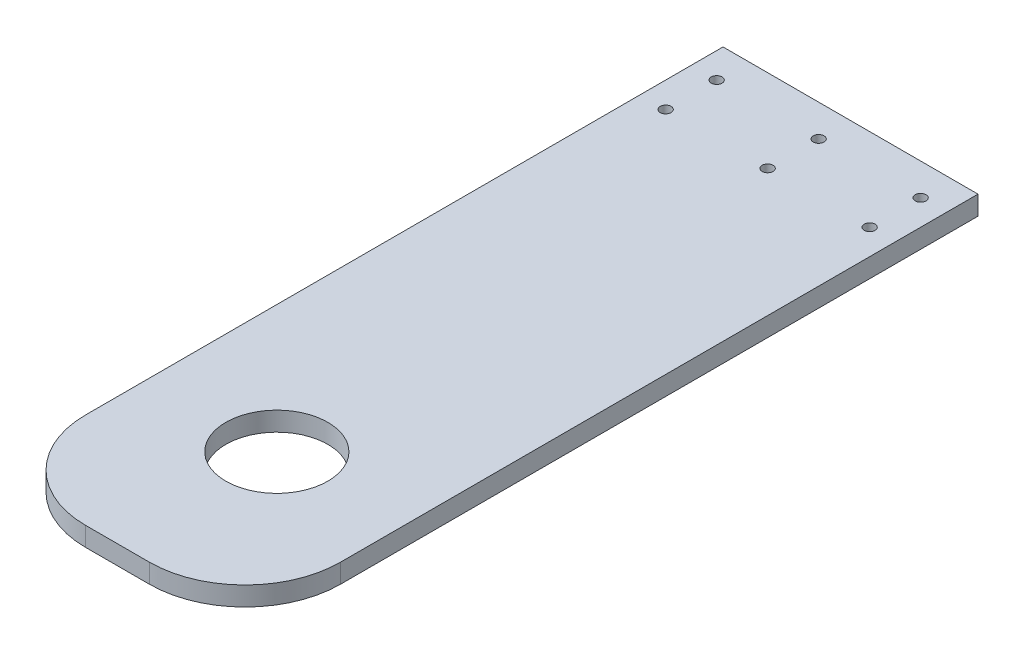
from build123d import *

# Parameters (mm, degrees)
SKETCH1_W                                           = 80
SKETCH1_H                                           = 230
BOSS_EXTRUDE1_DEPTH                                 = 6
F_32_0_32_DIAMETER_HOLE1_D                          = 32
FILLET1_R                                           = 30
CBORE_FOR_M3_HEX_SOCKET_HEAD_CAP_SCREW1_D           = 3.4
CBORE_FOR_M3_HEX_SOCKET_HEAD_CAP_SCREW1_CBORE_D     = 6.5
CBORE_FOR_M3_HEX_SOCKET_HEAD_CAP_SCREW1_CBORE_DEPTH = 3.4


with BuildPart() as part:
    # Sketch1 → Boss-Extrude1 (new body)
    with BuildSketch(Plane(origin=(0, 0, 0), x_dir=(1, 0, 0), z_dir=(0, 1, 0))):
        with Locations((40, -115)):
            Rectangle(SKETCH1_W, SKETCH1_H)
    extrude(amount=BOSS_EXTRUDE1_DEPTH)

    # Ø32.0 (32) Diameter Hole1 (through all)
    with Locations(Plane(origin=(0, 6, 0), x_dir=(1, 0, 0), z_dir=(0, 1, 0))):
        with Locations((40, -180)):
            Hole(F_32_0_32_DIAMETER_HOLE1_D / 2)

    # Fillet1
    fillet1_edges = [part.edges().sort_by_distance(p)[0] for p in [
        (0, 3, 230),
        (80, 3, 230),
    ]]
    fillet(fillet1_edges, radius=FILLET1_R)

    # CBORE for M3 Hex Socket Head Cap Screw1 (through all)
    with Locations(Plane.XZ):
        with Locations((8, 10), (40, 10), (72, 10), (40, 26), (72, 26), (8, 26)):
            CounterBoreHole(CBORE_FOR_M3_HEX_SOCKET_HEAD_CAP_SCREW1_D / 2, CBORE_FOR_M3_HEX_SOCKET_HEAD_CAP_SCREW1_CBORE_D / 2, CBORE_FOR_M3_HEX_SOCKET_HEAD_CAP_SCREW1_CBORE_DEPTH)


solid = part.part
